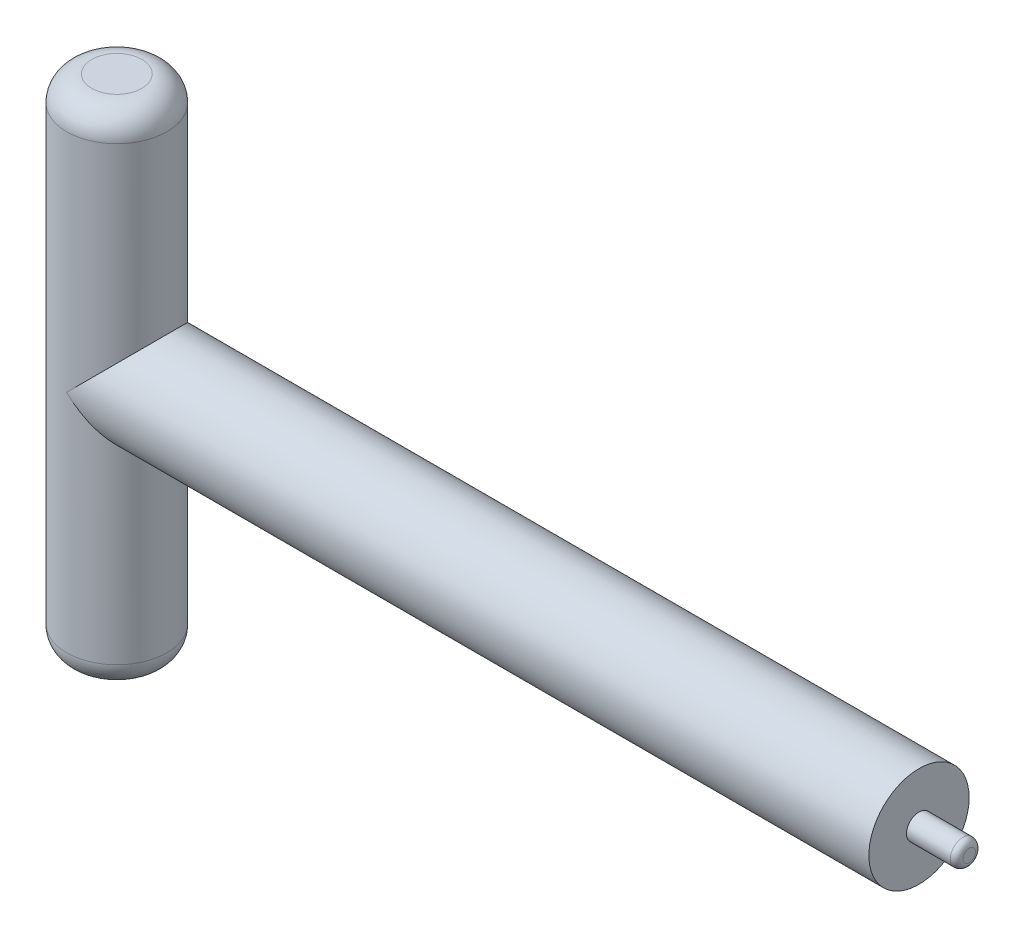
from build123d import *

# Parameters (mm, degrees)
SKETCH1_R                = 12.7
BOSS_EXTRUDE1_DEPTH      = 203.2
SKETCH2_R                = 3.175
BOSS_EXTRUDE2_DEPTH      = 12.7
FILLET2_R                = 1.5875
BOSS_EXTRUDE3_DEPTH      = 63.5
BOSS_EXTRUDE3_DEPTH_BACK = 63.5
SKETCH3_R                = 12.7
FILLET3_R                = 6.35


with BuildPart() as part:
    # Sketch1 → Boss-Extrude1 (new body)
    with BuildSketch(Plane(origin=(0, 0, 0), x_dir=(0, 0, -1), z_dir=(1, 0, 0))):
        Circle(SKETCH1_R)
    extrude(amount=BOSS_EXTRUDE1_DEPTH)

    # Sketch2 → Boss-Extrude2 (add)
    with BuildSketch(Plane(origin=(203.2, 0, 0), x_dir=(0, 0, -1), z_dir=(1, 0, 0))):
        Circle(SKETCH2_R)
    extrude(amount=BOSS_EXTRUDE2_DEPTH)

    # Fillet2
    fillet2_edges = [part.edges().sort_by_distance(p)[0] for p in [
        (215.9, 0, 3.175),
    ]]
    fillet(fillet2_edges, radius=FILLET2_R)

    # Sketch3 → Boss-Extrude3 (add, two sides: drawn at the far end of the back side and taken through both)
    with BuildSketch(Plane(origin=(0, 0, 0), x_dir=(1, 0, 0), z_dir=(0, 1, 0)).offset(-BOSS_EXTRUDE3_DEPTH_BACK)):
        with Locations(Location((0, 0, 0), (0, 0, 270))):
            Circle(SKETCH3_R)
    extrude(amount=BOSS_EXTRUDE3_DEPTH + BOSS_EXTRUDE3_DEPTH_BACK)

    # Fillet3
    # the kernel refuses this fillet: 6.35 mm, written as the material it takes off along each edge
    with BuildSketch(Plane(origin=(0, 63.5, 0), x_dir=(0, 0, 1), z_dir=(-1, 0, 0))) as fillet3_piece_1:
        with BuildLine():
            CenterArc((12.7 - FILLET3_R, -FILLET3_R), FILLET3_R, 0, 90)
            Line((12.7 - FILLET3_R, 0), (12.7, 0))
            Line((12.7, 0), (12.7, -FILLET3_R))
        make_face()
    revolve(axis=Axis((0, 63.5, 0), (0, 1, 0)), mode=Mode.SUBTRACT)
    with BuildSketch(Plane(origin=(0, -63.5, 0), x_dir=(0, 0, 1), z_dir=(-1, 0, 0))) as fillet3_piece_2:
        with BuildLine():
            CenterArc((12.7 - FILLET3_R, FILLET3_R), FILLET3_R, 270, 90)
            Line((12.7 - FILLET3_R, 0), (12.7, 0))
            Line((12.7, 0), (12.7, FILLET3_R))
        make_face()
    revolve(axis=Axis((0, -63.5, 0), (0, 1, 0)), mode=Mode.SUBTRACT)


solid = part.part
